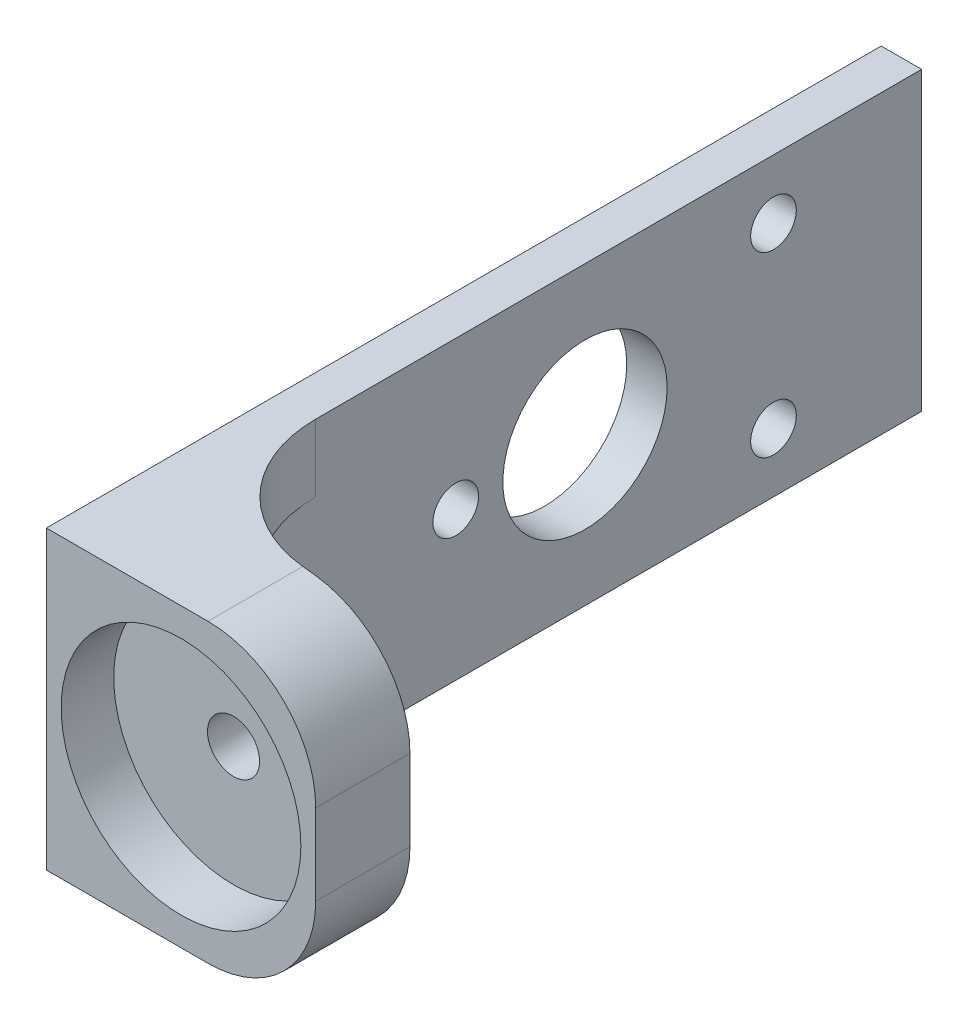
from build123d import *

# Parameters (mm, degrees)
SKETCH1_W                 = 3.81
SKETCH1_H                 = 78.74
SKETCH1_W_2               = 21.59
SKETCH1_H_2               = 8.89
BOSS_EXTRUDE1_DEPTH       = 27.94
SKETCH2_R                 = 11.303
CUT_EXTRUDE1_DEPTH        = 4.953
F_8_CLEARANCE_HOLE1_D     = 4.9149
CUT_EXTRUDE4_REACH        = 88.295
SKETCH5_R                 = 7.747
F_6_CLEARANCE_HOLE1_D     = 4.3053
F_6_CLEARANCE_HOLE1_DEPTH = 3.81
FILLET1_DEPTH             = 6.35
FILLET2_START             = 21.59
FILLET2_DEPTH             = 6.35
FILLET3_R                 = 10.16


with BuildPart() as part:
    # Sketch1 → Boss-Extrude1 (new body)
    with BuildSketch(Plane(origin=(0, 0, 0), x_dir=(1, 0, 0), z_dir=(0, 1, 0))):
        with Locations((1.905, 39.37)):
            Rectangle(SKETCH1_W, SKETCH1_H)
        with Locations((14.605, 4.445)):
            Rectangle(SKETCH1_W_2, SKETCH1_H_2)
    extrude(amount=BOSS_EXTRUDE1_DEPTH)

    # Sketch2 → Cut-Extrude1 (cut)
    with BuildSketch(Plane.XY):
        with Locations((12.7, 13.97)):
            Circle(SKETCH2_R)
    extrude(amount=-CUT_EXTRUDE1_DEPTH, mode=Mode.SUBTRACT)

    # #8 Clearance Hole1 (through all)
    with Locations(Plane.XY.offset(-4.953)):
        with Locations((12.7, 13.97)):
            Hole(F_8_CLEARANCE_HOLE1_D / 2)

    # Sketch5 → Cut-Extrude4 (cut, up to next)
    with BuildSketch(Plane(origin=(3.81, 0, 0), x_dir=(0, 0, -1), z_dir=(1, 0, 0)), mode=Mode.PRIVATE) as cut_extrude4_sk1:
        with Locations((46.99, 13.97)):
            Circle(SKETCH5_R)
    cut_extrude4_tool1 = extrude(cut_extrude4_sk1.sketch, amount=-CUT_EXTRUDE4_REACH, mode=Mode.PRIVATE) & part.part
    # Sketch5 → Cut-Extrude4 (cut, up to next)
    with BuildSketch(Plane(origin=(3.81, 0, 0), x_dir=(0, 0, -1), z_dir=(1, 0, 0)), mode=Mode.PRIVATE) as cut_extrude4_sk2:
        with BuildLine():
            ThreePointArc((54.737, 13.97), (46.99, 21.717), (39.243, 13.97))
            Line((39.243, 13.97), (54.737, 13.97))
        make_face()
    cut_extrude4_tool2 = extrude(cut_extrude4_sk2.sketch, amount=-CUT_EXTRUDE4_REACH, mode=Mode.PRIVATE) & part.part
    # Sketch5 → Cut-Extrude4 (cut, up to next)
    with BuildSketch(Plane(origin=(3.81, 0, 0), x_dir=(0, 0, -1), z_dir=(1, 0, 0)), mode=Mode.PRIVATE) as cut_extrude4_sk3:
        with BuildLine():
            Line((54.737, 13.97), (39.243, 13.97))
            ThreePointArc((39.243, 13.97), (46.99, 6.223), (54.737, 13.97))
        make_face()
    cut_extrude4_tool3 = extrude(cut_extrude4_sk3.sketch, amount=-CUT_EXTRUDE4_REACH, mode=Mode.PRIVATE) & part.part
    add(cut_extrude4_tool1.solids().sort_by_distance((3.81, 13.97, -46.99))[0], mode=Mode.SUBTRACT)
    add(cut_extrude4_tool2.solids().sort_by_distance((3.81, 17.257929, -46.99))[0], mode=Mode.SUBTRACT)
    add(cut_extrude4_tool3.solids().sort_by_distance((3.81, 10.682071, -46.99))[0], mode=Mode.SUBTRACT)

    # #6 Clearance Hole1
    with Locations(Plane(origin=(3.81, 0, 0), x_dir=(0, 0, -1), z_dir=(1, 0, 0))):
        with Locations((34.798, 13.97), (46.99, 13.97), (64.77, 22.352), (64.77, 5.588)):
            Hole(F_6_CLEARANCE_HOLE1_D / 2, depth=F_6_CLEARANCE_HOLE1_DEPTH)

    # Fillet1: read off the stored shape, not the designer's step
    # Fillet1 outline → Fillet1 (add)
    with BuildSketch(Plane(origin=(0, 0, 0), x_dir=(1, 0, 0), z_dir=(0, 1, 0))):
        with BuildLine():
            ThreePointArc((16.51, 8.89), (7.529743879, 12.609743879), (3.81, 21.59))
            Line((3.81, 21.59), (3.81, 8.89))
            Line((3.81, 8.89), (16.51, 8.89))
        make_face()
    extrude(amount=FILLET1_DEPTH)

    # Fillet2: read off the stored shape, not the designer's step
    # Fillet2 outline → Fillet2 (add)
    with BuildSketch(Plane(origin=(0, 0, 0), x_dir=(1, 0, 0), z_dir=(0, 1, 0)).offset(FILLET2_START)):
        with BuildLine():
            ThreePointArc((16.51, 8.89), (7.529743879, 12.609743879), (3.81, 21.59))
            Line((3.81, 21.59), (3.81, 8.89))
            Line((3.81, 8.89), (16.51, 8.89))
        make_face()
    extrude(amount=FILLET2_DEPTH)

    # Fillet3
    fillet3_edges = [part.edges().sort_by_distance(p)[0] for p in [
        (25.4, 0, -4.445),
        (25.4, 27.94, -4.445),
    ]]
    fillet(fillet3_edges, radius=FILLET3_R)


solid = part.part
